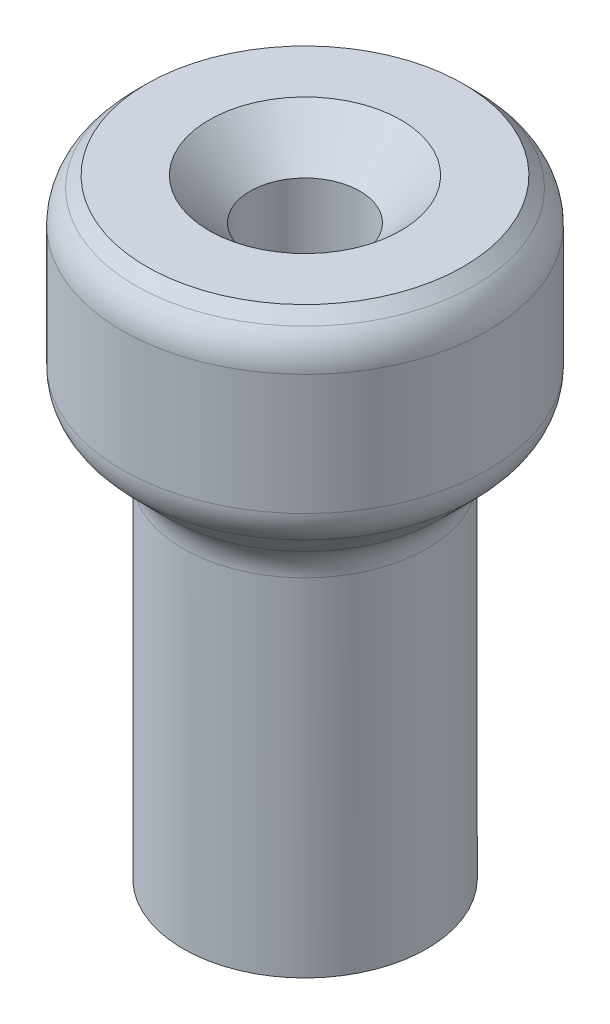
from build123d import *

# Parameters (mm, degrees)
SKETCH2_W                                       = 6
SKETCH2_H                                       = 6
SKETCH2_W_2                                     = 4
SKETCH2_H_2                                     = 14
CSK_FOR_M3_FLAT_HEAD_MACHINE_SCREW1_D           = 3.6
CSK_FOR_M3_FLAT_HEAD_MACHINE_SCREW1_CSINK_D     = 6.3
CSK_FOR_M3_FLAT_HEAD_MACHINE_SCREW1_CSINK_ANGLE = 90
CHAMFER1_SIZE                                   = 2
CHAMFER3_SIZE                                   = 0.8


with BuildPart() as part:
    # Sketch2 → Revolve1 (revolve)
    with BuildSketch(Plane.XY, mode=Mode.PRIVATE) as revolve1_sk:
        with Locations((3, 3)):
            Rectangle(SKETCH2_W, SKETCH2_H)
        with Locations((2, -7)):
            Rectangle(SKETCH2_W_2, SKETCH2_H_2)
    revolve(revolve1_sk.sketch.rotate(Axis((0, 0, 0), (0, -1, 0)), 180), axis=Axis((0, 0, 0), (0, -1, 0)))

    # CSK for M3 Flat Head Machine Screw1 (through all)
    with Locations(Plane(origin=(0, 6, 0), x_dir=(1, 0, 0), z_dir=(0, 1, 0))):
        with Locations((0, 0)):
            CounterSinkHole(CSK_FOR_M3_FLAT_HEAD_MACHINE_SCREW1_D / 2, CSK_FOR_M3_FLAT_HEAD_MACHINE_SCREW1_CSINK_D / 2, counter_sink_angle=CSK_FOR_M3_FLAT_HEAD_MACHINE_SCREW1_CSINK_ANGLE)

    # Chamfer1
    chamfer1_edges = [part.edges().sort_by_distance(p)[0] for p in [
        (4, 0, 0),
    ]]
    chamfer(chamfer1_edges, length=CHAMFER1_SIZE - 0.0001)  # a hair under: the kernel refuses the full size

    # Chamfer3
    chamfer3_edges = [part.edges().sort_by_distance(p)[0] for p in [
        (6, 6, 0),
    ]]
    chamfer(chamfer3_edges, length=CHAMFER3_SIZE)

    # Fillet1: read off the stored shape, not the designer's step
    # Fillet1 outline → Fillet1 (revolve, cut)
    with BuildSketch(Plane.XY):
        with BuildLine():
            ThreePointArc((5.560660172, 5.639339828), (5.885819299, 5.152704805), (6, 4.578679656))
            Line((6, 4.578679656), (6, 5.639339828))
            Line((6, 5.639339828), (5.560660172, 5.639339828))
        make_face()
        with BuildLine():
            Line((6, -0.439339828), (6, 0.621320344))
            ThreePointArc((6, 0.621320344), (5.885819299, 0.047295195), (5.560660172, -0.439339828))
            Line((5.560660172, -0.439339828), (6, -0.439339828))
        make_face()
    revolve(axis=Axis((0, 0, 0), (0, 1, 0)), mode=Mode.SUBTRACT)

    # Fillet1 2 outline → Fillet1 2 (revolve)
    with BuildSketch(Plane.XY):
        with BuildLine():
            ThreePointArc((4, -2.621320344), (4.114180701, -2.047295195), (4.439339828, -1.560660172))
            Line((4.439339828, -1.560660172), (4, -1.560660172))
            Line((4, -1.560660172), (4, -2.621320344))
        make_face()
    revolve(axis=Axis((0, 0, 0), (0, 1, 0)))


solid = part.part
